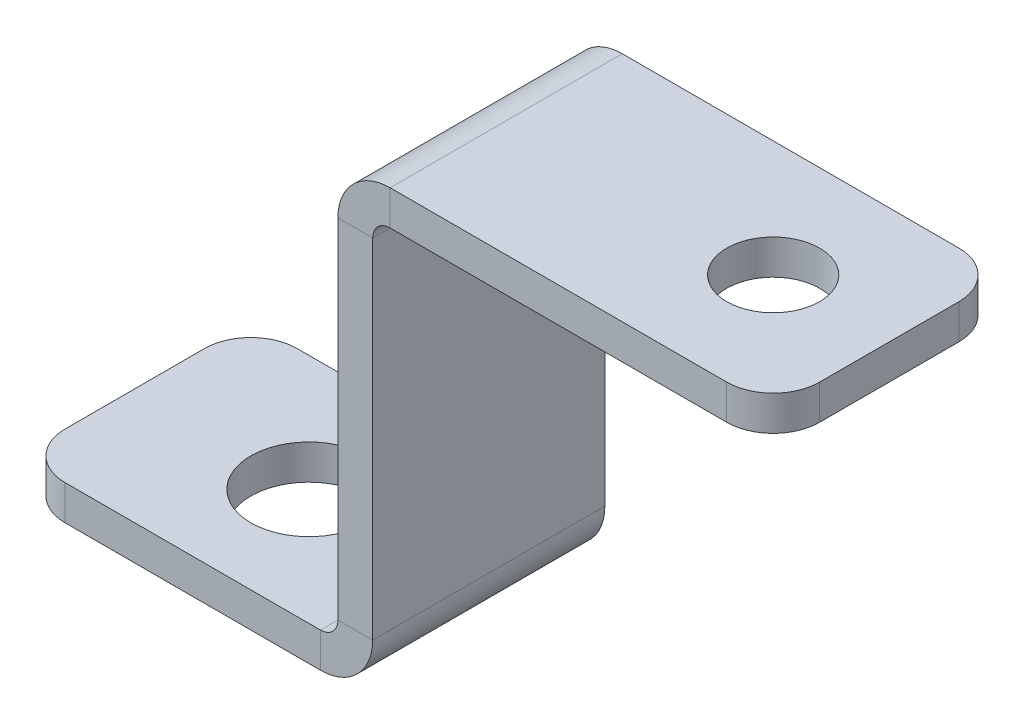
from build123d import *

# Parameters (mm, degrees)
BASE_FLANGE1_DEPTH = 10
SKETCH6_R          = 2.5
CUT_EXTRUDE1_DEPTH = 39.474017206
SKETCH7_R          = 2
CUT_EXTRUDE2_DEPTH = 40.198214245
FILLET1_R          = 2


# Sheet-metal steps are written as plain solids
with BuildPart() as part:
    # Sketch1 → Base-Flange1 (new body)
    with BuildSketch(Plane.XY):
        with BuildLine():
            Line((0, 0), (13, 0))
            ThreePointArc((13, 0), (13.530330086, 0.219669914), (13.75, 0.75))
            Line((13.75, 0.75), (13.75, 15.75))
            ThreePointArc((13.75, 15.75), (14.409009742, 17.340990258), (16, 18))
            Line((16, 18), (32.5, 18))
            Line((32.5, 18), (32.5, 16.5))
            Line((32.5, 16.5), (16, 16.5))
            ThreePointArc((16, 16.5), (15.469669914, 16.280330086), (15.25, 15.75))
            Line((15.25, 15.75), (15.25, 0.75))
            ThreePointArc((15.25, 0.75), (14.590990258, -0.840990258), (13, -1.5))
            Line((13, -1.5), (0, -1.5))
            Line((0, -1.5), (0, 0))
        make_face()
    extrude(amount=BASE_FLANGE1_DEPTH)

    # Sketch6 → Cut-Extrude1 (cut, through all)
    with BuildSketch(Plane(origin=(0, 0, 0), x_dir=(1, 0, 0), z_dir=(0, 1, 0))):
        with Locations(Location((7.5, -5, 0), (0, 0, 270))):
            Circle(SKETCH6_R)
    extrude(amount=-CUT_EXTRUDE1_DEPTH, mode=Mode.SUBTRACT)

    # Sketch7 → Cut-Extrude2 (cut, through all)
    with BuildSketch(Plane(origin=(0, 18, 0), x_dir=(1, 0, 0), z_dir=(0, 1, 0))):
        with Locations(Location((27.5, -5, 0), (0, 0, 270))):
            Circle(SKETCH7_R)
    extrude(amount=-CUT_EXTRUDE2_DEPTH, mode=Mode.SUBTRACT)

    # Fillet1
    fillet1_edges = [part.edges().sort_by_distance(p)[0] for p in [
        (0, -0.75, 0),
        (32.5, 17.25, 0),
        (0, -0.75, 10),
        (32.5, 17.25, 10),
    ]]
    fillet(fillet1_edges, radius=FILLET1_R)


solid = part.part
